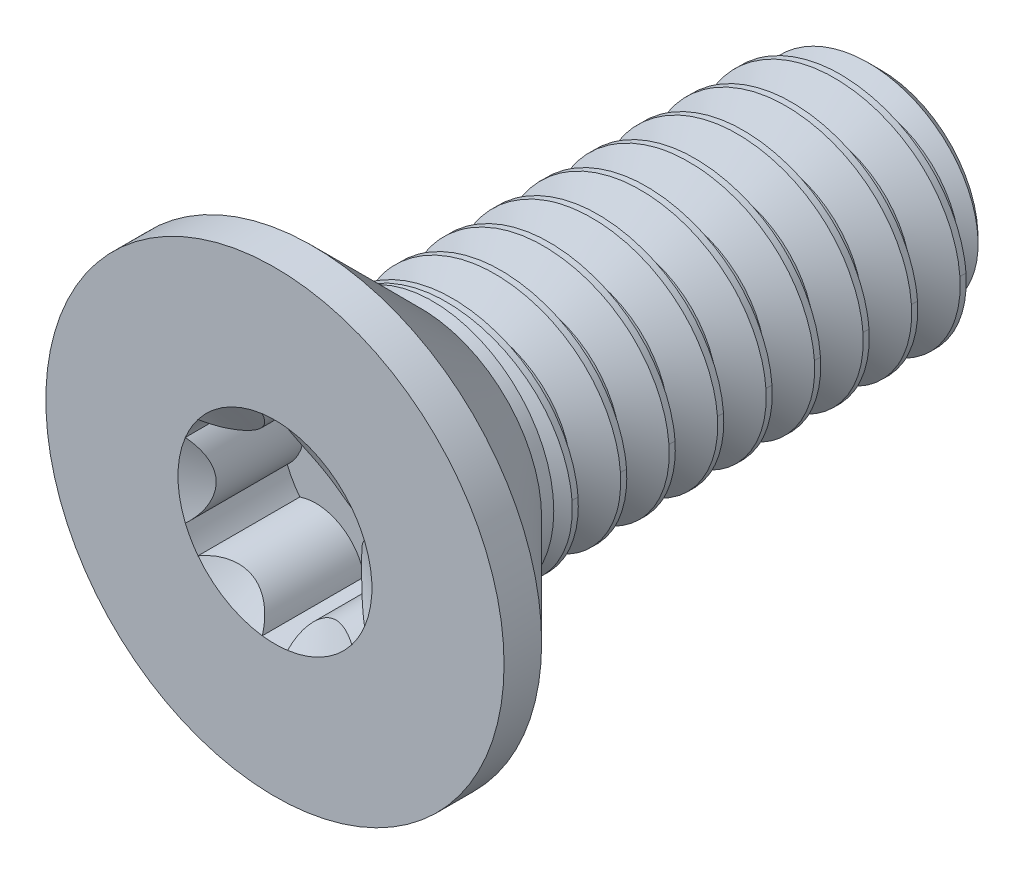
from build123d import *

# Parameters (mm, degrees)
CHAMFER1_SIZE      = 0.2
CUT_EXTRUDE2_DEPTH = 0.84
CIRPATTERN1_COUNT  = 6
CUT_SWEEP2_PITCH   = 0.4


with BuildPart() as part:
    # Sketch12 → Revolve3 (revolve)
    with BuildSketch(Plane(origin=(0, 0, 0), x_dir=(0, 0, -1), z_dir=(1, 0, 0)), mode=Mode.PRIVATE) as revolve3_sk:
        Polygon((0, 0), (5, 0), (5, 1), (1.2, 1), (0.31, 1.89), (0, 1.89), align=None)
    revolve(revolve3_sk.sketch.rotate(Axis((0, 0, 0), (0, 0, -1)), 90), axis=Axis((0, 0, 0), (0, 0, -1)))

    # Chamfer1
    chamfer1_edges = [part.edges().sort_by_distance(p)[0] for p in [
        (-1, 0, -5),
    ]]
    chamfer(chamfer1_edges, length=CHAMFER1_SIZE)

    # Sketch5 → Cut-Extrude2 (cut)
    with BuildSketch(Plane.XY):
        with BuildLine():
            Line((-0.692820323, -0.4), (0, 0))
            Line((0, 0), (-0.692820323, 0.4))
            ThreePointArc((-0.692820323, 0.4), (-0.717498193, 0.353830952), (-0.739103626, 0.306146746))
            ThreePointArc((-0.739103626, 0.306146746), (-0.6, 0), (-0.739103626, -0.306146746))
            ThreePointArc((-0.739103626, -0.306146746), (-0.717498193, -0.353830952), (-0.692820323, -0.4))
        make_face()
    cut_extrude2 = extrude(amount=-CUT_EXTRUDE2_DEPTH, mode=Mode.SUBTRACT)

    # CirPattern1: Cut-Extrude2 ×6 about axis
    cirpattern1_axis = Axis((0, 0, 0), (0, 0, 1))
    for i in range(1, CIRPATTERN1_COUNT):
        add(cut_extrude2.rotate(cirpattern1_axis, i * 360 / CIRPATTERN1_COUNT), mode=Mode.SUBTRACT)

    # Cut-Extrude3 cone 1 section (through the dimple's axis) → Cut-Extrude3 (revolve, cut)
    with BuildSketch(Plane(origin=(0, 0, 0), x_dir=(0, -1, 0), z_dir=(1, 0, 0))):
        Polygon((0, 0), (0.8, 0), (0, 0.461880215), align=None)
    revolve(axis=Axis((0, 0, 0), (0, 0, -1)), mode=Mode.SUBTRACT)


with BuildPart() as body_2:
    # Split1: the piece on the far side of the plane
    add(part.part)
    split(bisect_by=Plane.XY.offset(-1.2), keep=Keep.BOTTOM)

    # Cut-Sweep2: the profile of Sketch14 screwed along a right-hand helix of 10.45 turns, 6 arcs to a turn; built about Z, then put on its axis
    cut_sweep2_z = Axis((0, 0, 0), (0, 0, 1))
    cut_sweep2_corners = [(0.740192379, 0, -0.15), (0.740192379, 0, -0.2), (1.021650635, 0, -0.3625), (1.021650635, 0, 0.0125)]
    with BuildLine(mode=Mode.PRIVATE) as cut_sweep2_profile:
        Line(cut_sweep2_corners[0], cut_sweep2_corners[1])
        Line(cut_sweep2_corners[1], cut_sweep2_corners[2])
        Line(cut_sweep2_corners[2], cut_sweep2_corners[3])
        Line(cut_sweep2_corners[3], cut_sweep2_corners[0])
    cut_sweep2_cap = Face(cut_sweep2_profile.wire())
    cut_sweep2_turn_angles = [0, 30, 60, 90, 120, 150, 180, 210, 240, 270, 300, 330, 360]
    cut_sweep2_turn_weights = [1, 0.8660254037844387, 1, 0.8660254037844387, 1, 0.8660254037844387, 1, 0.8660254037844387, 1, 0.8660254037844387, 1, 0.8660254037844387, 1]
    cut_sweep2_turn_rails = [Edge.make_bspline([Vector(p[0], p[1], 0).rotate(cut_sweep2_z, cut_sweep2_turn_angles[k]) / cut_sweep2_turn_weights[k] + Vector(0, 0, p[2] + CUT_SWEEP2_PITCH * cut_sweep2_turn_angles[k] / 360) for k in range(13)], [0, 0, 0, 1, 1, 2, 2, 3, 3, 4, 4, 5, 5, 6, 6, 6], 2, cut_sweep2_turn_weights) for p in cut_sweep2_corners]
    cut_sweep2_turn_sides = [Face.make_surface_from_curves(cut_sweep2_turn_rails[p[0]], cut_sweep2_turn_rails[p[1]]) for p in [(0, 1), (1, 2), (2, 3), (3, 0)]]
    cut_sweep2_turn = Solid(Shell([*cut_sweep2_turn_sides, cut_sweep2_cap, cut_sweep2_cap.rotate(cut_sweep2_z, 360).moved(Location((0, 0, CUT_SWEEP2_PITCH * 360 / 360)))]))
    cut_sweep2_last_angles = [3600, 3630, 3660, 3690, 3720, 3741, 3762]
    cut_sweep2_last_weights = [1, 0.8660254037844387, 1, 0.8660254037844387, 1, 0.9335804264971292, 1]
    cut_sweep2_last_rails = [Edge.make_bspline([Vector(p[0], p[1], 0).rotate(cut_sweep2_z, cut_sweep2_last_angles[k]) / cut_sweep2_last_weights[k] + Vector(0, 0, p[2] + CUT_SWEEP2_PITCH * cut_sweep2_last_angles[k] / 360) for k in range(7)], [0, 0, 0, 1, 1, 2, 2, 3, 3, 3], 2, cut_sweep2_last_weights) for p in cut_sweep2_corners]
    cut_sweep2_last_sides = [Face.make_surface_from_curves(cut_sweep2_last_rails[p[0]], cut_sweep2_last_rails[p[1]]) for p in [(0, 1), (1, 2), (2, 3), (3, 0)]]
    cut_sweep2_last = Solid(Shell([*cut_sweep2_last_sides, cut_sweep2_cap.rotate(cut_sweep2_z, 3600).moved(Location((0, 0, CUT_SWEEP2_PITCH * 3600 / 360))), cut_sweep2_cap.rotate(cut_sweep2_z, 3762).moved(Location((0, 0, CUT_SWEEP2_PITCH * 3762 / 360)))]))
    cut_sweep2_each = [*[cut_sweep2_turn.moved(Location((0, 0, CUT_SWEEP2_PITCH * i))) for i in range(10)], cut_sweep2_last]
    add(Plane(origin=(0, 0, -5), x_dir=(0, 1, 0), z_dir=(0, 0, 1)) * Compound([cut_sweep2_each[i] for i in range(0, 11, 2)]), mode=Mode.SUBTRACT)
    add(Plane(origin=(0, 0, -5), x_dir=(0, 1, 0), z_dir=(0, 0, 1)) * Compound([cut_sweep2_each[i] for i in range(1, 11, 2)]), mode=Mode.SUBTRACT)


with BuildPart() as part_1:
    add(part.part)

    # Split1
    split(bisect_by=Plane.XY.offset(-1.2), keep=Keep.TOP)

    add(body_2.part)  # Revolve4 merges body 2
    # Sketch15 → Revolve4 (revolve)
    with BuildSketch(Plane(origin=(0, 0, 0), x_dir=(0, 0, -1), z_dir=(1, 0, 0)), mode=Mode.PRIVATE) as revolve4_sk:
        Polygon((1.2, 1), (1.3, 1), (1.877350269, 0), (1.2, 0), align=None)
    revolve(revolve4_sk.sketch.rotate(Axis((0, 0, 0), (0, 0, -1)), 90), axis=Axis((0, 0, 0), (0, 0, -1)))


solid = part_1.part
